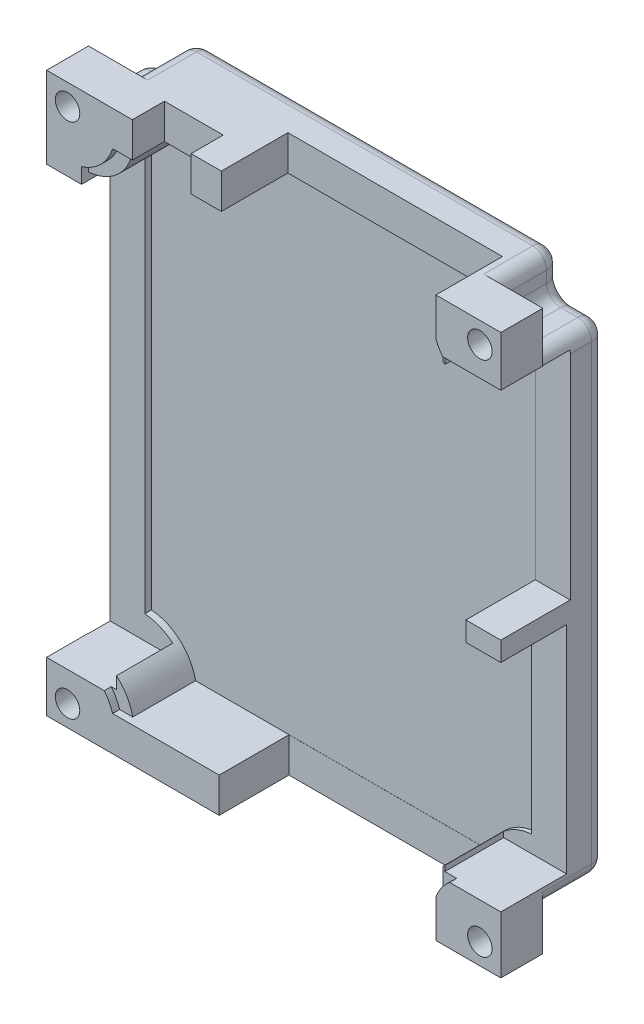
from build123d import *

# Parameters (mm, degrees)
SKETCH1_W           = 65
SKETCH1_H           = 80
BOSS_EXTRUDE1_DEPTH = 15
SKETCH2_R           = 1.75
CUT_EXTRUDE1_DEPTH  = 15
SKETCH3_W           = 6.452545503
SKETCH3_H           = 5.641605939
CUT_EXTRUDE2_DEPTH  = 9
FILLET1_R           = 2
SHELL1_START        = -10
SHELL1_DEPTH        = 10
SHELL1_START_2      = -1
SHELL1_2_DEPTH      = 1
SKETCH4_W           = 31
SKETCH4_H           = 9.988916405
CUT_EXTRUDE3_DEPTH  = 9
SKETCH5_W           = 9.944131197
SKETCH5_H           = 30.964366914
SKETCH5_W_2         = 9.409197356
SKETCH5_H_2         = 30.907117663
CUT_EXTRUDE4_DEPTH  = 9
SKETCH6_W           = 8.400929104
SKETCH6_H           = 4.591319751
SKETCH6_W_2         = 30.7
SKETCH6_H_2         = 9.525851227
CUT_EXTRUDE5_DEPTH  = 9
CUT_EXTRUDE6_DEPTH  = 9


# Read off the part's stored shape, not the designer's step: Shell1
with BuildPart() as part:
    # Sketch1 → Boss-Extrude1 (new body)
    with BuildSketch(Plane.XY):
        with Locations((-32.5, 40)):
            Rectangle(SKETCH1_W, SKETCH1_H)
    extrude(amount=-BOSS_EXTRUDE1_DEPTH)

    # Sketch2 → Cut-Extrude1 (cut)
    with BuildSketch(Plane.XY):
        with Locations((-3, 3)):
            Circle(SKETCH2_R)
        with Locations((-62, 3)):
            Circle(SKETCH2_R)
        with Locations((-62, 77)):
            Circle(SKETCH2_R)
        with Locations((-3, 77)):
            Circle(SKETCH2_R)
    extrude(amount=-CUT_EXTRUDE1_DEPTH, mode=Mode.SUBTRACT)

    # Sketch3 → Cut-Extrude2 (cut)
    with BuildSketch(Plane(origin=(0, 0, -15), x_dir=(-1, 0, 0), z_dir=(0, 0, -1))):
        with Locations((3.226272752, 77.179197031)):
            Rectangle(SKETCH3_W, SKETCH3_H)
        with Locations((61.773727249, 77.179197031)):
            Rectangle(SKETCH3_W, SKETCH3_H)
        with Locations((3.226272752, 2.82080297)):
            Rectangle(SKETCH3_W, SKETCH3_H)
        with Locations((61.773727249, 2.82080297)):
            Rectangle(SKETCH3_W, SKETCH3_H)
    extrude(amount=-CUT_EXTRUDE2_DEPTH, mode=Mode.SUBTRACT)

    # Fillet1
    fillet1_edges = [part.edges().sort_by_distance(p)[0] for p in [
        (-32.5, 0, -15),
        (-65, 40, -15),
        (-32.5, 80, -15),
        (0, 40, -15),
        (-58.547454497, 77.17919703, -15),
        (-61.773727249, 74.358394061, -15),
        (-58.547454497, 74.358394061, -10.5),
        (-58.547454497, 80, -10.5),
        (-65, 74.358394061, -10.5),
        (-6.452545503, 2.82080297, -15),
        (-3.226272751, 5.641605939, -15),
        (0, 5.641605939, -10.5),
        (-6.452545503, 5.641605939, -10.5),
        (-6.452545503, 0, -10.5),
        (-58.547454497, 2.82080297, -15),
        (-61.773727249, 5.641605939, -15),
        (-58.547454497, 0, -10.5),
        (-58.547454497, 5.641605939, -10.5),
        (-65, 5.641605939, -10.5),
        (-3.226272751, 74.358394061, -15),
        (-6.452545503, 77.17919703, -15),
        (0, 74.358394061, -10.5),
        (-6.452545503, 80, -10.5),
        (-6.452545503, 74.358394061, -10.5),
    ]]
    fillet(fillet1_edges, radius=FILLET1_R)

    # Shell1 outline → Shell1 (cut)
    with BuildSketch(Plane.XY.offset(SHELL1_START)):
        with BuildLine():
            ThreePointArc((-11.319478266, 5), (-9.104410686, 8.872299041), (-5, 10.620165502))
            Line((-5, 10.620165502), (-5, 69.379834498))
            ThreePointArc((-5, 69.379834498), (-9.104410686, 71.127700959), (-11.319478266, 75))
            Line((-11.319478266, 75), (-53.680521734, 75))
            ThreePointArc((-53.680521734, 75), (-55.895589314, 71.127700959), (-60, 69.379834498))
            Line((-60, 69.379834498), (-60, 10.620165502))
            ThreePointArc((-60, 10.620165502), (-55.895589314, 8.872299041), (-53.680521734, 5))
            Line((-53.680521734, 5), (-11.319478266, 5))
        make_face()
    extrude(amount=SHELL1_DEPTH, mode=Mode.SUBTRACT)

    # Shell1 2 outline → Shell1 2 (cut)
    with BuildSketch(Plane.XY.offset(SHELL1_START_2)):
        with BuildLine():
            ThreePointArc((-9.446898479, 5), (-7.772970773, 7.772970773), (-5, 9.446898479))
            Line((-5, 9.446898479), (-5, 10.620165502))
            ThreePointArc((-5, 10.620165502), (-9.104410686, 8.872299041), (-11.319478266, 5))
            Line((-11.319478266, 5), (-9.446898479, 5))
        make_face()
        with BuildLine():
            ThreePointArc((-11.319478266, 75), (-9.104410686, 71.127700959), (-5, 69.379834498))
            Line((-5, 69.379834498), (-5, 70.553101521))
            ThreePointArc((-5, 70.553101521), (-7.772970773, 72.227029227), (-9.446898479, 75))
            Line((-9.446898479, 75), (-11.319478266, 75))
        make_face()
        with BuildLine():
            Line((-55.553101521, 5), (-53.680521734, 5))
            ThreePointArc((-53.680521734, 5), (-55.895589314, 8.872299041), (-60, 10.620165502))
            Line((-60, 10.620165502), (-60, 9.446898479))
            ThreePointArc((-60, 9.446898479), (-57.227029227, 7.772970773), (-55.553101521, 5))
        make_face()
        with BuildLine():
            ThreePointArc((-60, 69.379834498), (-55.895589314, 71.127700959), (-53.680521734, 75))
            Line((-53.680521734, 75), (-55.553101521, 75))
            ThreePointArc((-55.553101521, 75), (-57.227029227, 72.227029227), (-60, 70.553101521))
            Line((-60, 70.553101521), (-60, 69.379834498))
        make_face()
    extrude(amount=SHELL1_2_DEPTH, mode=Mode.SUBTRACT)

    # Sketch4 → Cut-Extrude3 (cut)
    with BuildSketch(Plane.XZ):
        with Locations((-24.8, -4.994458203)):
            Rectangle(SKETCH4_W, SKETCH4_H)
    extrude(amount=-CUT_EXTRUDE3_DEPTH, mode=Mode.SUBTRACT)

    # Sketch5 → Cut-Extrude4 (cut)
    with BuildSketch(Plane(origin=(0, 0, 0), x_dir=(0, 0, -1), z_dir=(1, 0, 0))):
        with Locations((4.972065599, 57.356572465)):
            Rectangle(SKETCH5_W, SKETCH5_H)
        with Locations((4.704598678, 23.640694869)):
            Rectangle(SKETCH5_W_2, SKETCH5_H_2)
    extrude(amount=-CUT_EXTRUDE4_DEPTH, mode=Mode.SUBTRACT)

    # Sketch6 → Cut-Extrude5 (cut)
    with BuildSketch(Plane(origin=(0, 80, 0), x_dir=(1, 0, 0), z_dir=(0, 1, 0))):
        with Locations((-48.526627408, 2.295659876)):
            Rectangle(SKETCH6_W, SKETCH6_H)
        with Locations((-24.643720135, 4.762925614)):
            Rectangle(SKETCH6_W_2, SKETCH6_H_2)
    extrude(amount=-CUT_EXTRUDE5_DEPTH, mode=Mode.SUBTRACT)

    # Sketch7 → Cut-Extrude6 (cut)
    with BuildSketch(Plane.ZY.offset(65)):
        Polygon((-0.41148, 7.238999939), (0, 7.238999939), (0, 68.347517032), (-0.41148, 68.347517032), (-9.049681563, 68.347517032), (-9.049681563, 7.238999939), align=None)
    extrude(amount=-CUT_EXTRUDE6_DEPTH, mode=Mode.SUBTRACT)


solid = part.part
